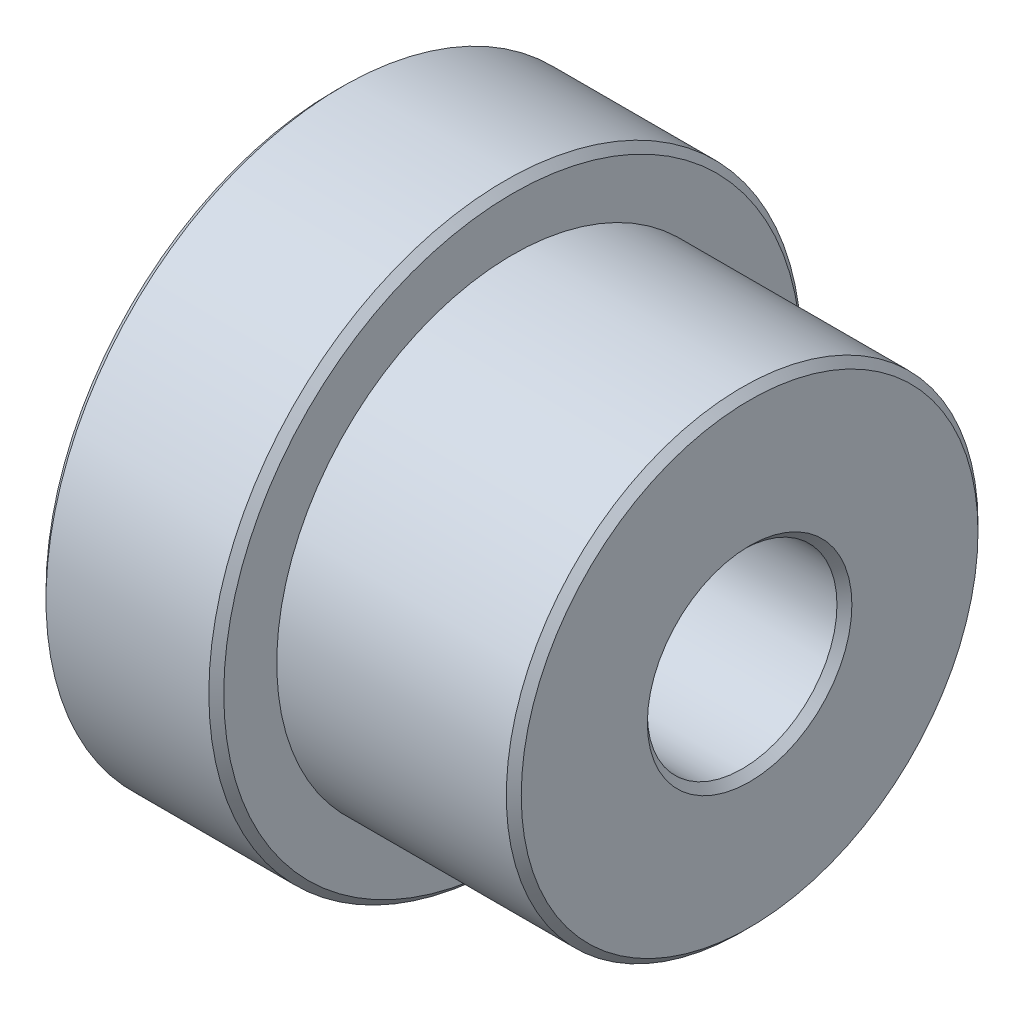
from build123d import *

# Parameters (mm, degrees)
SKETCH1_R           = 12.6365
BOSS_EXTRUDE1_DEPTH = 12.7
SKETCH2_R           = 15.875
BOSS_EXTRUDE2_DEPTH = 9.525
SKETCH3_R           = 11.1125
CUT_EXTRUDE1_DEPTH  = 7.112
SKETCH4_R           = 7.27458794
CUT_EXTRUDE2_DEPTH  = 0.2
SKETCH5_R           = 5.08
CUT_EXTRUDE3_DEPTH  = 27.952343479
CHAMFER1_SIZE       = 0.4


with BuildPart() as part:
    # Sketch1 → Boss-Extrude1 (new body)
    with BuildSketch(Plane(origin=(0, 0, 0), x_dir=(0, 0, -1), z_dir=(1, 0, 0))):
        Circle(SKETCH1_R)
    extrude(amount=BOSS_EXTRUDE1_DEPTH)

    # Sketch2 → Boss-Extrude2 (add)
    with BuildSketch(Plane.ZY):
        Circle(SKETCH2_R)
    extrude(amount=BOSS_EXTRUDE2_DEPTH)

    # Sketch3 → Cut-Extrude1 (cut)
    with BuildSketch(Plane.ZY.offset(9.525)):
        Circle(SKETCH3_R)
    extrude(amount=-CUT_EXTRUDE1_DEPTH, mode=Mode.SUBTRACT)

    # Sketch4 → Cut-Extrude2 (cut)
    with BuildSketch(Plane.ZY.offset(2.413)):
        Circle(SKETCH4_R)
    extrude(amount=-CUT_EXTRUDE2_DEPTH, mode=Mode.SUBTRACT)

    # Sketch5 → Cut-Extrude3 (cut, through all)
    with BuildSketch(Plane.ZY.offset(2.213)):
        Circle(SKETCH5_R)
    extrude(amount=-CUT_EXTRUDE3_DEPTH, mode=Mode.SUBTRACT)

    # Chamfer1
    chamfer1_edges = [part.edges().sort_by_distance(p)[0] for p in [
        (12.7, 0, 12.6365),
        (12.7, 0, -5.08),
        (-9.525, 0, -15.875),
        (-9.525, 0, -11.1125),
        (0, 0, -15.875),
    ]]
    chamfer(chamfer1_edges, length=CHAMFER1_SIZE)


solid = part.part
